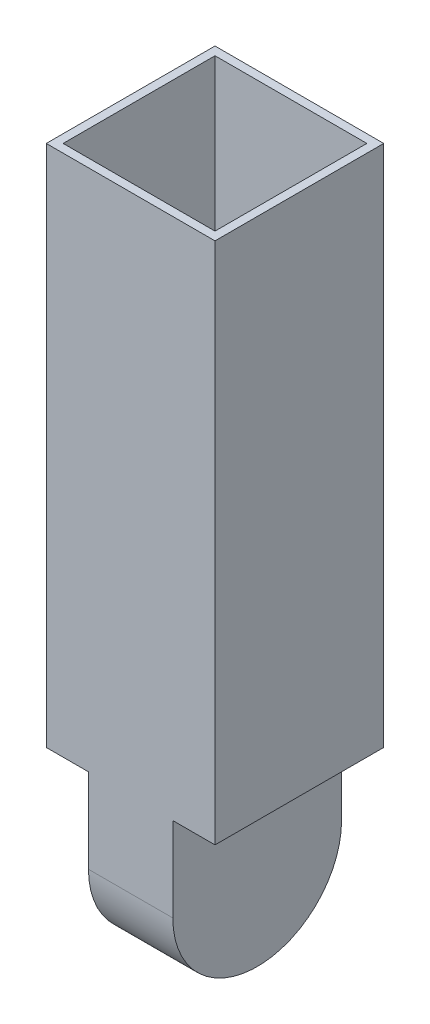
from build123d import *

# Parameters (mm, degrees)
SKETCH_1_W      = 20
SKETCH_1_H      = 20
SKETCH_1_W_2    = 18
SKETCH_1_H_2    = 18
EXTRUDE_1_DEPTH = 60
SKETCH_2_W      = 20
SKETCH_2_H      = 20
EXTRUDE_2_DEPTH = 2
EXTRUDE_3_DEPTH = 5


with BuildPart() as part:
    # 草图1 → 凸台-拉伸1 (new body)
    with BuildSketch(Plane(origin=(0, 0, 0), x_dir=(1, 0, 0), z_dir=(0, 1, 0))):
        Rectangle(SKETCH_1_W, SKETCH_1_H)
        Rectangle(SKETCH_1_W_2, SKETCH_1_H_2, mode=Mode.SUBTRACT)
    extrude(amount=EXTRUDE_1_DEPTH)

    # 草图2 → 凸台-拉伸2 (add)
    with BuildSketch(Plane.XZ):
        Rectangle(SKETCH_2_W, SKETCH_2_H)
    extrude(amount=EXTRUDE_2_DEPTH)

    # 草图6 → 凸台-拉伸3 (add, symmetric)
    with BuildSketch(Plane(origin=(0, 0, 0), x_dir=(0, 0, -1), z_dir=(1, 0, 0))):
        with BuildLine():
            Line((-10, -2), (10, -2))
            Line((10, -2), (10, -12))
            ThreePointArc((10, -12), (0, -22), (-10, -12))
            Line((-10, -12), (-10, -2))
        make_face()
    extrude(amount=EXTRUDE_3_DEPTH, both=True)


solid = part.part
